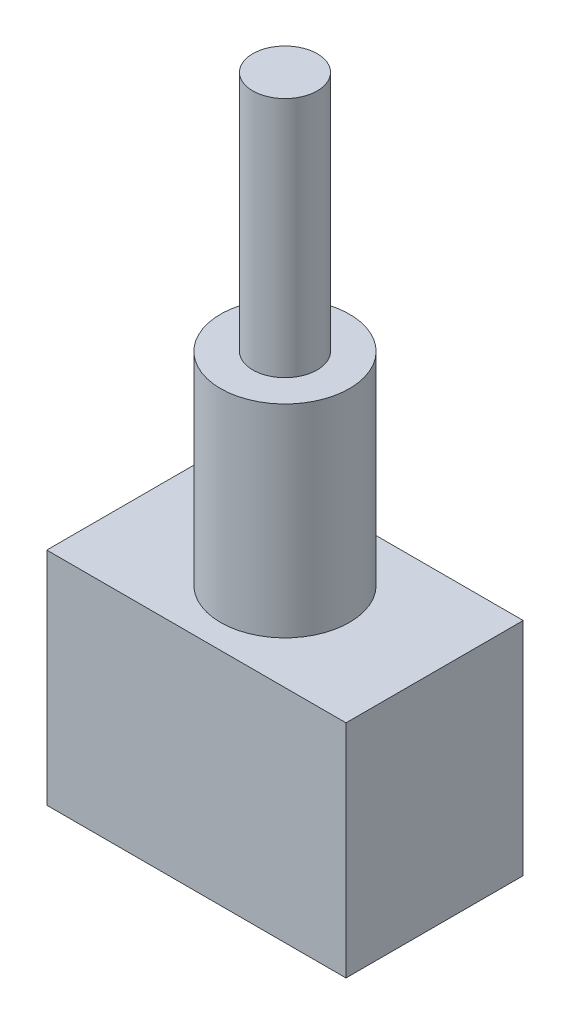
from build123d import *

# Parameters (mm, degrees)
ESBO_O2_W                = 13
ESBO_O2_H                = 9.6
RESSALTO_EXTRUS_O1_DEPTH = 7.7
ESBO_O3_R                = 2.8
RESSALTO_EXTRUS_O2_DEPTH = 8.8
ESBO_O5_R                = 1.4
RESSALTO_EXTRUS_O3_DEPTH = 10.5


with BuildPart() as part:
    # Esboço2 → Ressalto-extrusão1 (new body)
    with BuildSketch(Plane.XY):
        with Locations((6.5, 4.8)):
            Rectangle(ESBO_O2_W, ESBO_O2_H)
    extrude(amount=RESSALTO_EXTRUS_O1_DEPTH)

    # Esboço3 → Ressalto-extrusão2 (add)
    with BuildSketch(Plane(origin=(0, 9.6, 0), x_dir=(1, 0, 0), z_dir=(0, 1, 0))):
        with Locations((6.5, -3.85)):
            Circle(ESBO_O3_R)
    extrude(amount=RESSALTO_EXTRUS_O2_DEPTH)

    # Esboço5 → Ressalto-extrusão3 (add)
    with BuildSketch(Plane(origin=(0, 18.4, 0), x_dir=(1, 0, 0), z_dir=(0, 1, 0))):
        with Locations((6.5, -3.85)):
            Circle(ESBO_O5_R)
    extrude(amount=RESSALTO_EXTRUS_O3_DEPTH)


solid = part.part
